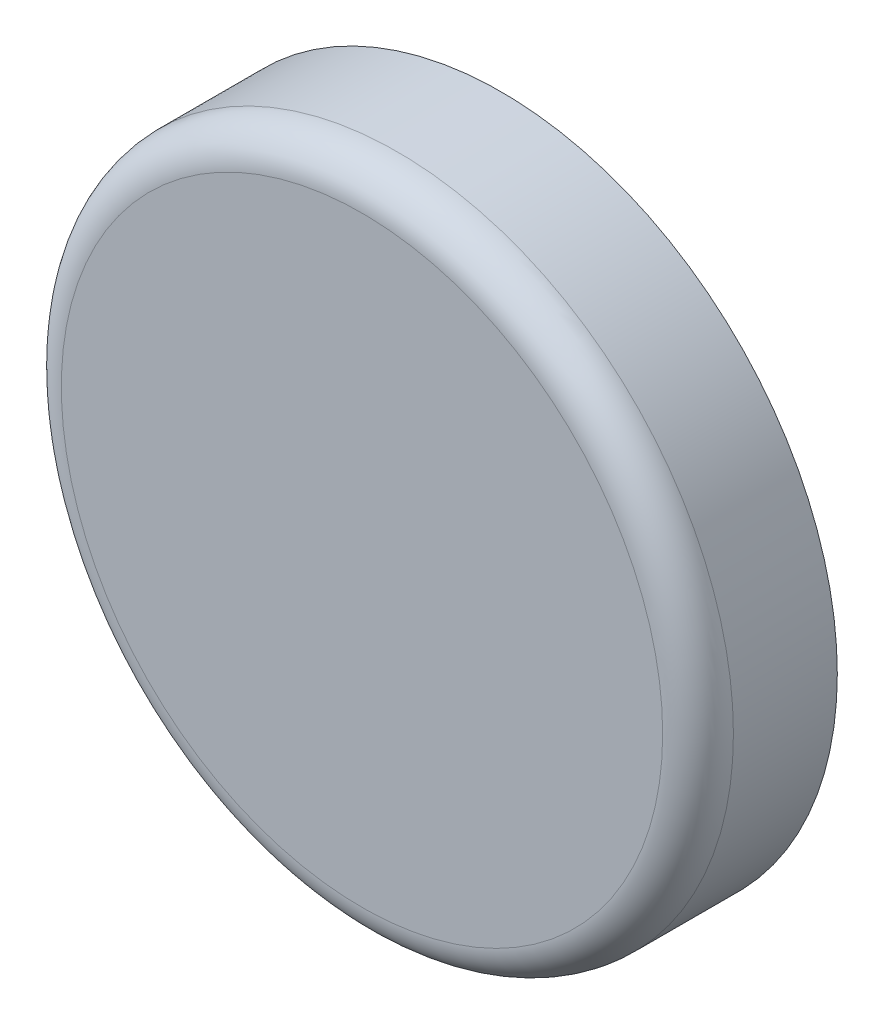
from build123d import *

# Parameters (mm, degrees)
SKETCH1_R           = 12.065
BOSS_EXTRUDE1_DEPTH = 5
FILLET1_R           = 1.27


with BuildPart() as part:
    # Sketch1 → Boss-Extrude1 (new body)
    with BuildSketch(Plane.XY):
        Circle(SKETCH1_R)
    extrude(amount=BOSS_EXTRUDE1_DEPTH)

    # Fillet1
    fillet1_edges = [part.edges().sort_by_distance(p)[0] for p in [
        (-12.065, 0, 5),
    ]]
    fillet(fillet1_edges, radius=FILLET1_R)


solid = part.part
